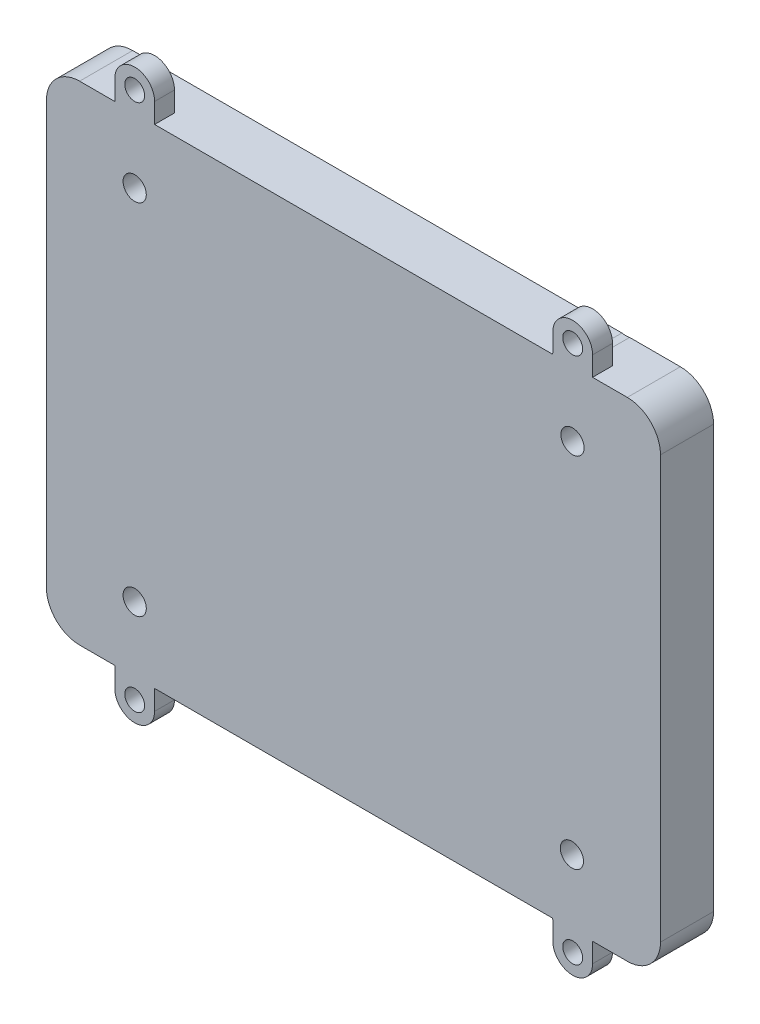
from build123d import *

# Parameters (mm, degrees)
DRAFT_2_R           = 1.5
EXTRUDE_1_DEPTH     = 3
EXTRUDE_START       = -5
EXTRUDE_2_DEPTH     = 5
DRAFT_6_R           = 1.75
CUT_EXTRUDE_7_DEPTH = 64.227785822


with BuildPart() as part:
    # draft 2 → 凸台-拉伸1 (new body)
    with BuildSketch(Plane.XY):
        with BuildLine():
            ThreePointArc((-46.27, -31.8), (-44.805533906, -35.335533906), (-41.27, -36.8))
            Line((-41.27, -36.8), (-35.97, -36.8))
            Line((-35.97, -36.8), (-35.97, -39.8))
            ThreePointArc((-35.97, -39.8), (-32.97, -42.8), (-29.97, -39.8))
            Line((-29.97, -39.8), (-29.97, -36.8))
            Line((-29.97, -36.8), (30.034045372, -36.8))
            Line((30.034045372, -36.8), (30.039172016, -39.747818111))
            ThreePointArc((30.039172016, -39.747818111), (33.044384867, -42.742596187), (36.039162942, -39.737383337))
            Line((36.039162942, -39.737383337), (36.034054446, -36.8))
            Line((36.034054446, -36.8), (41.27, -36.8))
            ThreePointArc((41.27, -36.8), (44.805533906, -35.335533906), (46.27, -31.8))
            Line((46.27, -31.8), (46.27, 31.8))
            ThreePointArc((46.27, 31.8), (44.805533906, 35.335533906), (41.27, 36.8))
            Line((41.27, 36.8), (36.034054446, 36.8))
            Line((36.034054446, 36.8), (36.039162942, 39.737383337))
            ThreePointArc((36.039162942, 39.737383337), (33.044384867, 42.742596187), (30.039172016, 39.747818111))
            Line((30.039172016, 39.747818111), (30.034045372, 36.8))
            Line((30.034045372, 36.8), (-29.97, 36.8))
            Line((-29.97, 36.8), (-29.97, 39.8))
            ThreePointArc((-29.97, 39.8), (-32.97, 42.8), (-35.97, 39.8))
            Line((-35.97, 39.8), (-35.97, 36.8))
            Line((-35.97, 36.8), (-41.27, 36.8))
            ThreePointArc((-41.27, 36.8), (-44.805533906, 35.335533906), (-46.27, 31.8))
            Line((-46.27, 31.8), (-46.27, -31.8))
        make_face()
        with Locations((-32.97, 39.8)):
            Circle(DRAFT_2_R, mode=Mode.SUBTRACT)
        with Locations((33.039167479, 39.742600724)):
            Circle(DRAFT_2_R, mode=Mode.SUBTRACT)
        with Locations((33.039167479, -39.742600724)):
            Circle(DRAFT_2_R, mode=Mode.SUBTRACT)
        with Locations((-32.97, -39.8)):
            Circle(DRAFT_2_R, mode=Mode.SUBTRACT)
    extrude(amount=EXTRUDE_1_DEPTH)

    # draft<5> → 凸台-拉伸2 (add)
    with BuildSketch(Plane.XY.offset(EXTRUDE_START)):
        with BuildLine():
            ThreePointArc((-46.27, -31.8), (-44.805533906, -35.335533906), (-41.27, -36.8))
            Line((-41.27, -36.8), (-35.97, -36.8))
            Line((-35.97, -36.8), (-32.97, -36.8))
            Line((-32.97, -36.8), (-29.97, -36.8))
            Line((-29.97, -36.8), (30.034045372, -36.8))
            Line((30.034045372, -36.8), (32.455128971, -36.8))
            ThreePointArc((32.455128971, -36.8), (33.039167479, -36.742600724), (33.623205988, -36.8))
            Line((33.623205988, -36.8), (36.034054446, -36.8))
            Line((36.034054446, -36.8), (41.27, -36.8))
            ThreePointArc((41.27, -36.8), (44.805533906, -35.335533906), (46.27, -31.8))
            Line((46.27, -31.8), (46.27, 31.8))
            ThreePointArc((46.27, 31.8), (44.805533906, 35.335533906), (41.27, 36.8))
            Line((41.27, 36.8), (36.034054446, 36.8))
            Line((36.034054446, 36.8), (33.623205988, 36.8))
            ThreePointArc((33.623205988, 36.8), (33.039167479, 36.742600724), (32.455128971, 36.8))
            Line((32.455128971, 36.8), (30.034045372, 36.8))
            Line((30.034045372, 36.8), (-29.97, 36.8))
            Line((-29.97, 36.8), (-32.97, 36.8))
            Line((-32.97, 36.8), (-35.97, 36.8))
            Line((-35.97, 36.8), (-41.27, 36.8))
            ThreePointArc((-41.27, 36.8), (-44.805533906, 35.335533906), (-46.27, 31.8))
            Line((-46.27, 31.8), (-46.27, -31.8))
        make_face()
        Polygon((-44.27, 29.8), (-39.27, 34.8), (39.33, 34.8), (44.33, 29.8), (44.33, -29.8), (39.33, -34.8), (-39.27, -34.8), (-44.27, -29.8), align=None, mode=Mode.SUBTRACT)
    extrude(amount=EXTRUDE_2_DEPTH)

    # draft<6> → 切除-拉伸7 (cut, through all)
    with BuildSketch(Plane.XY):
        with Locations((-32.97, 27)):
            Circle(DRAFT_6_R)
        with Locations((-32.97, -27)):
            Circle(DRAFT_6_R)
        with Locations((32.922993654, -27.057298255)):
            Circle(DRAFT_6_R)
        with Locations((33.016906626, 26.942620081)):
            Circle(DRAFT_6_R)
    extrude(amount=CUT_EXTRUDE_7_DEPTH, mode=Mode.SUBTRACT)


solid = part.part
